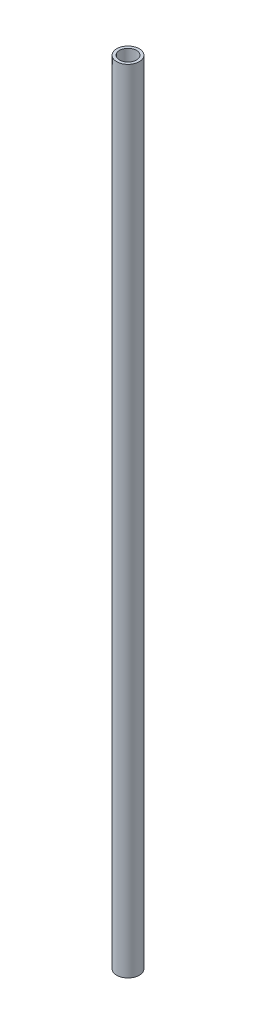
from build123d import *

# Parameters (mm, degrees)
SKETCH1_R           = 6.35
SKETCH1_R_2         = 4.7625
BOSS_EXTRUDE1_DEPTH = 446.2018


with BuildPart() as part:
    # Sketch1 → Boss-Extrude1 (new body)
    with BuildSketch(Plane(origin=(0, 0, 0), x_dir=(1, 0, 0), z_dir=(0, 1, 0))):
        Circle(SKETCH1_R)
        Circle(SKETCH1_R_2, mode=Mode.SUBTRACT)
    extrude(amount=BOSS_EXTRUDE1_DEPTH)


solid = part.part
